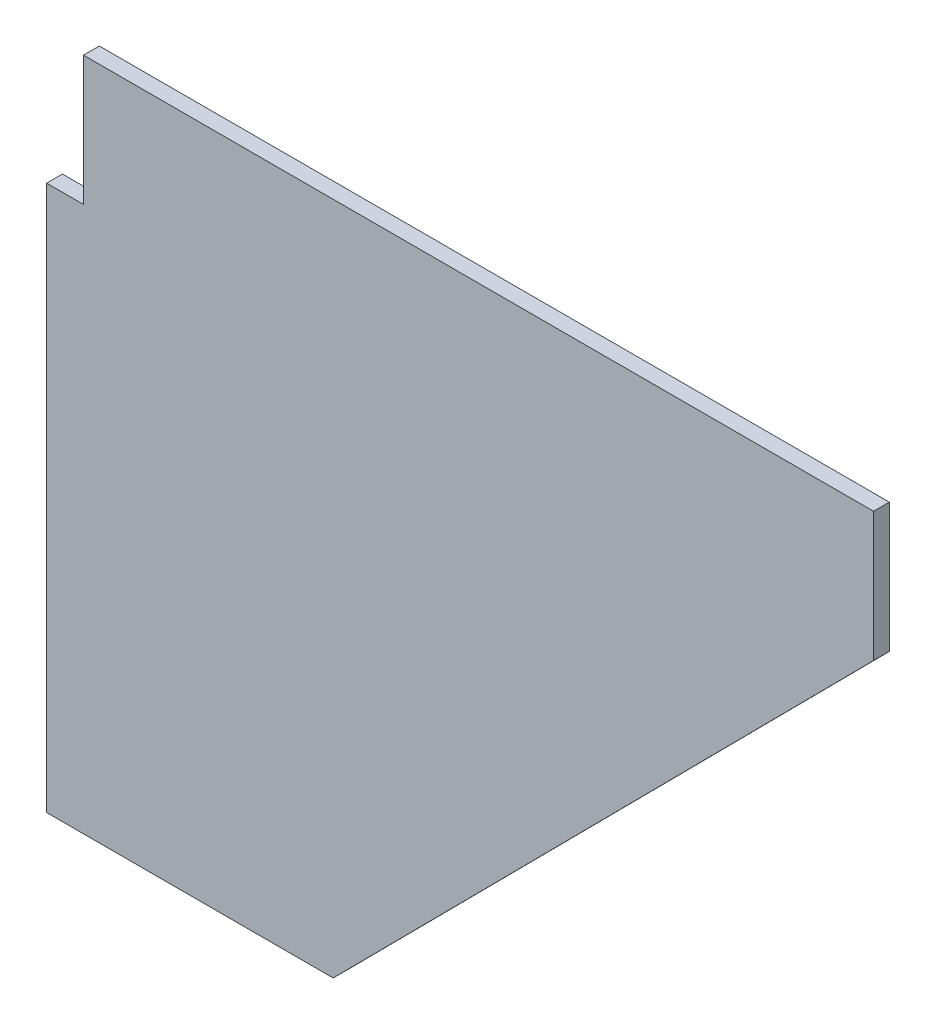
from build123d import *

# Parameters (mm, degrees)
BOSS_EXTRU_1_DEPTH = 3


with BuildPart() as part:
    # Esquisse2 → Boss.-Extru.1 (new body)
    with BuildSketch(Plane.XY):
        Polygon((6.230769231, -24.551), (13.230769231, -24.551), (13.230769231, 0), (163.230769231, 0), (163.230769231, -24.551), (60.636186506, -128.038407915), (6.230769231, -128.038407915), align=None)
    extrude(amount=BOSS_EXTRU_1_DEPTH)


solid = part.part
